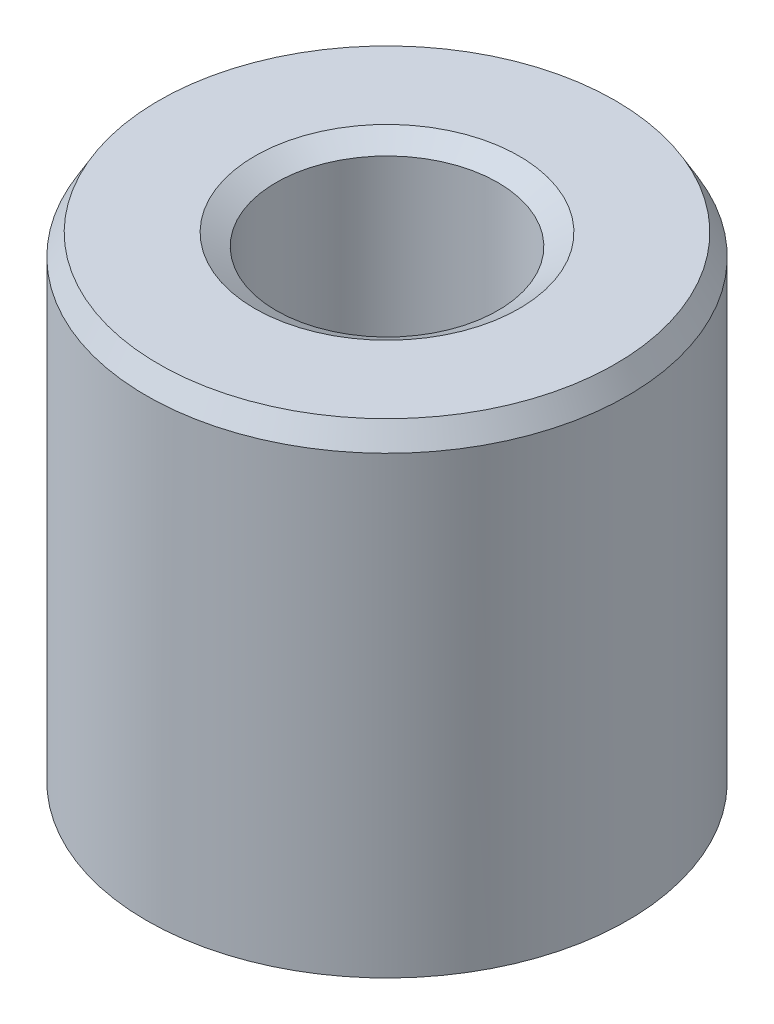
from build123d import *
from OCP.BRepFilletAPI import BRepFilletAPI_MakeChamfer

# Parameters (mm, degrees)
SKETCH1_R           = 17.5
BOSS_EXTRUDE1_DEPTH = 35.495455852
SKETCH2_R           = 8.067514356
CUT_EXTRUDE1_DEPTH  = 44.271554007
CHAMFER1_SIZE       = 1.54771508
CHAMFER1_SIZE2      = 0.893573718


with BuildPart() as part:
    # Sketch1 → Boss-Extrude1 (new body)
    with BuildSketch(Plane(origin=(0, 0, 0), x_dir=(1, 0, 0), z_dir=(0, 1, 0))):
        Circle(SKETCH1_R)
    extrude(amount=BOSS_EXTRUDE1_DEPTH)

    # Sketch2 → Cut-Extrude1 (cut, through all)
    with BuildSketch(Plane(origin=(0, 0, 0), x_dir=(1, 0, 0), z_dir=(0, 1, 0))):
        Circle(SKETCH2_R)
    extrude(amount=CUT_EXTRUDE1_DEPTH, mode=Mode.SUBTRACT)

    # Chamfer1: one chamfer whose edges measure the first distance from different faces: ONE call of the kernel's chamfer builder (chamfer() names one face for all edges)
    chamfer1_edges_1 = [part.edges().sort_by_distance(p)[0] for p in [
        (-8.067514356, 35.495455852, 0),
    ]]
    chamfer1_side_1 = [part.faces().sort_by_distance(p)[0] for p in [
        (-17.005025253, 35.495455852, 0),
    ]]
    chamfer1_edges_2 = [part.edges().sort_by_distance(p)[0] for p in [
        (-8.067514356, 0, 0),
    ]]
    chamfer1_side_2 = [part.faces().sort_by_distance(p)[0] for p in [
        (-8.067514356, 17.747727926, 0),
    ]]
    chamfer1_edges_3 = [part.edges().sort_by_distance(p)[0] for p in [
        (-17.5, 0, 0),
    ]]
    chamfer1_side_3 = [part.faces().sort_by_distance(p)[0] for p in [
        (-17.005025253, 0, 0),
    ]]
    chamfer1_edges_4 = [part.edges().sort_by_distance(p)[0] for p in [
        (-17.5, 35.495455852, 0),
    ]]
    chamfer1_side_4 = [part.faces().sort_by_distance(p)[0] for p in [
        (-17.5, 17.747727926, 0),
    ]]
    chamfer1 = BRepFilletAPI_MakeChamfer(part.part.solid().wrapped)
    for e in chamfer1_edges_1:
        chamfer1.Add(CHAMFER1_SIZE, CHAMFER1_SIZE2, e.wrapped, chamfer1_side_1[0].wrapped)  # the first distance lies on this face
    for e in chamfer1_edges_2:
        chamfer1.Add(CHAMFER1_SIZE, CHAMFER1_SIZE2, e.wrapped, chamfer1_side_2[0].wrapped)  # the first distance lies on this face
    for e in chamfer1_edges_3:
        chamfer1.Add(CHAMFER1_SIZE, CHAMFER1_SIZE2, e.wrapped, chamfer1_side_3[0].wrapped)  # the first distance lies on this face
    for e in chamfer1_edges_4:
        chamfer1.Add(CHAMFER1_SIZE, CHAMFER1_SIZE2, e.wrapped, chamfer1_side_4[0].wrapped)  # the first distance lies on this face
    add(Compound.cast(chamfer1.Shape()), mode=Mode.REPLACE)


solid = part.part
